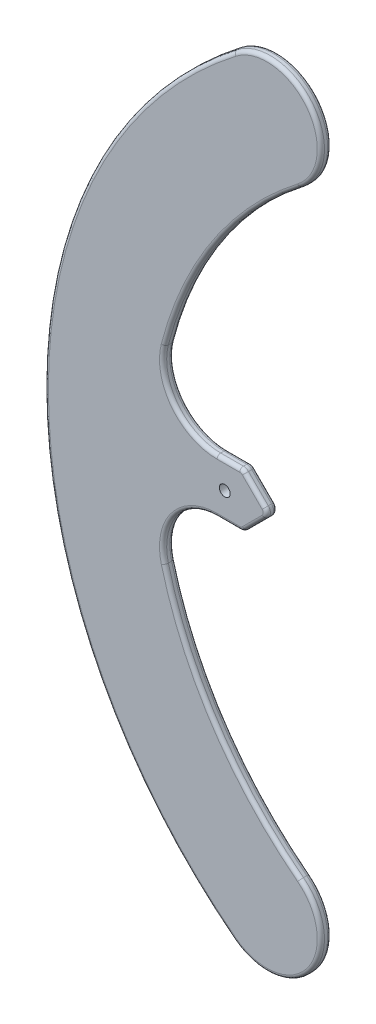
from build123d import *

# Parameters (mm, degrees)
SKETCH1_R           = 1.5
BOSS_EXTRUDE1_DEPTH = 2.9
FILLET1_R           = 15
FILLET2_R           = 2
FILLET3_R           = 1


with BuildPart() as part:
    # Sketch1 → Boss-Extrude1 (new body)
    with BuildSketch(Plane.XY):
        with BuildLine():
            ThreePointArc((-11.978690202, -106.875000176), (9.060608576, -104.164298847), (6.349907492, -83.125000037))
            ThreePointArc((6.349907492, -83.125000037), (-22.020584681, -49.648176304), (-34.231800328, -7.5))
            Line((-34.231800328, -7.5), (-9.5, -7.5))
            Line((-9.5, -7.5), (-2, 0))
            Line((-2, 0), (-9.5, 7.5))
            Line((-9.5, 7.5), (-34.231800328, 7.5))
            ThreePointArc((-34.231800328, 7.5), (-22.020584787, 49.648176107), (6.349907137, 83.124999763))
            ThreePointArc((6.349907137, 83.124999763), (9.060608638, 104.164298767), (-11.978690398, 106.875000025))
            ThreePointArc((-11.978690398, 106.875000025), (-64.5, -1.24e-07), (-11.978690202, -106.875000176))
        make_face()
        with Locations((-14.5, 0)):
            Circle(SKETCH1_R, mode=Mode.SUBTRACT)
    extrude(amount=BOSS_EXTRUDE1_DEPTH)

    # Fillet1
    fillet1_edges = [part.edges().sort_by_distance(p)[0] for p in [
        (-34.231800328, -7.5, 1.45),
        (-34.231800328, 7.5, 1.45),
    ]]
    fillet(fillet1_edges, radius=FILLET1_R)

    # Fillet2
    fillet2_edges = [part.edges().sort_by_distance(p)[0] for p in [
        (-9.5, -7.5, 1.45),
        (-9.5, 7.5, 1.45),
        (-2, 0, 1.45),
    ]]
    fillet(fillet2_edges, radius=FILLET2_R)

    # Fillet3
    fillet3_edges = [part.edges().sort_by_distance(p)[0] for p in [
        (-9.56306026, 7.347759065, 2.9),
        (-6.164213562, 4.164213562, 2.9),
        (-2.828427125, 0, 2.9),
        (-6.164213562, -4.164213562, 2.9),
        (-9.56306026, -7.347759065, 2.9),
        (-13.485276207, -7.5, 2.9),
        (-28.500666515, -13.314413465, 2.9),
        (-17.149415422, -57.815049738, 2.9),
        (9.060608576, -104.164298847, 2.9),
        (-64.5, -1.24e-07, 2.9),
        (9.060608638, 104.164298767, 2.9),
        (-17.149415545, 57.815049551, 2.9),
        (-17.149415545, 57.815049551, 0),
        (9.060608638, 104.164298767, 0),
        (-64.5, -1.24e-07, 0),
        (9.060608576, -104.164298847, 0),
        (-17.149415422, -57.815049738, 0),
        (-28.500666515, -13.314413465, 0),
        (-13.485276207, -7.5, 0),
        (-9.56306026, -7.347759065, 0),
        (-6.164213562, -4.164213562, 0),
        (-2.828427125, 0, 0),
        (-6.164213562, 4.164213562, 0),
        (-9.56306026, 7.347759065, 0),
        (-28.500666515, 13.314413465, 2.9),
        (-28.500666515, 13.314413465, 0),
        (-13.485276207, 7.5, 2.9),
        (-13.485276207, 7.5, 0),
    ]]
    fillet(fillet3_edges, radius=FILLET3_R)


solid = part.part
